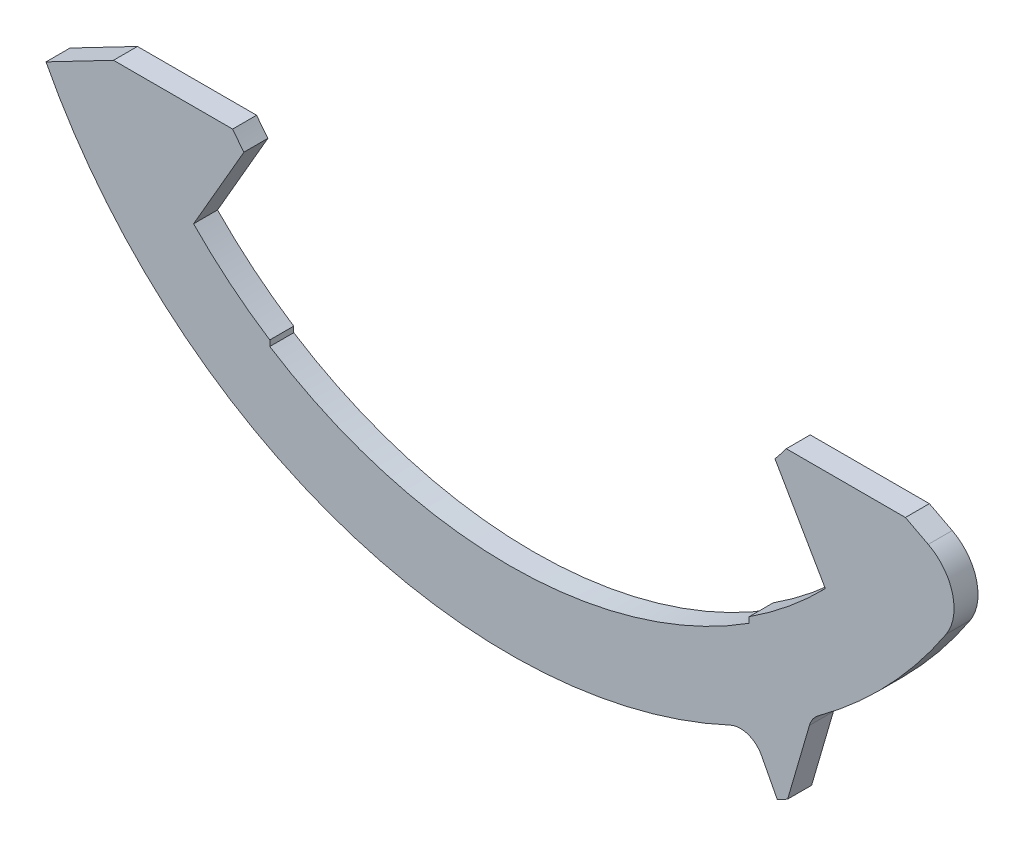
from build123d import *

# Parameters (mm, degrees)
OTHER_10076_5_DEPTH = 0.5
CUT_EXTRUDE1_START  = -0.5
CUT_EXTRUDE1_DEPTH  = 0.5


# Read off the part's stored shape, not the designer's step: 10076-5
with BuildPart() as part:
    # Other 10076-5 outline → Other 10076-5 (new body)
    with BuildSketch(Plane.XY):
        with BuildLine():
            ThreePointArc((7.573674013, -9.436602245), (7.668819519, -9.359444812), (7.763179028, -9.281328104))
            Line((7.763179028, -9.281328104), (7.919995926, -7.488902759))
            ThreePointArc((7.919995926, -7.488902759), (8.548470738, -6.76266575), (9.110578105, -5.983925684))
            ThreePointArc((9.110578105, -5.983925684), (9.242448569, -5.182849851), (8.736493865, -4.547930843))
            Line((8.736493865, -4.547930843), (8.260223146, -4.3))
            Line((8.260223146, -4.3), (5.774945887, -4.3))
            ThreePointArc((5.774945887, -4.3), (5.659072475, -4.451392897), (5.53923133, -4.5996648))
            Line((5.53923133, -4.5996648), (6.59, -6.419649523))
            ThreePointArc((6.59, -6.419649523), (5.831509763, -7.1157216), (5, -7.722693831))
            Line((5, -7.722693831), (5, -7.841555968))
            ThreePointArc((5, -7.841555968), (0, -9.3), (-5, -7.841555968))
            Line((-5, -7.841555968), (-5, -7.722693831))
            ThreePointArc((-5, -7.722693831), (-5.831509763, -7.1157216), (-6.59, -6.419649523))
            Line((-6.59, -6.419649523), (-5.53923133, -4.5996648))
            ThreePointArc((-5.53923133, -4.5996648), (-5.659072475, -4.451392897), (-5.774945887, -4.3))
            Line((-5.774945887, -4.3), (-8.260223146, -4.3))
            Line((-8.260223146, -4.3), (-10.732831081, -5.58715822))
            ThreePointArc((-10.732831081, -5.58715822), (-10.675718173, -5.6955282), (-10.617511084, -5.803314431))
            Line((-10.617511084, -5.803314431), (-9.055174855, -6.258693914))
            ThreePointArc((-9.055174855, -6.258693914), (-8.704696722, -6.64117368), (-8.882127626, -7.128661083))
            Line((-8.882127626, -7.128661083), (-9.436602245, -7.573674013))
            ThreePointArc((-9.436602245, -7.573674013), (-9.359444812, -7.668819519), (-9.281328104, -7.763179028))
            Line((-9.281328104, -7.763179028), (-7.660171598, -7.905011844))
            ThreePointArc((-7.660171598, -7.905011844), (-7.241809703, -8.211767477), (-7.320727248, -8.724502998))
            Line((-7.320727248, -8.724502998), (-7.777730077, -9.269137762))
            ThreePointArc((-7.777730077, -9.269137762), (-7.683493234, -9.347402405), (-7.588468891, -9.424709008))
            Line((-7.588468891, -9.424709008), (-5.970792243, -9.247544602))
            ThreePointArc((-5.970792243, -9.247544602), (-5.500623999, -9.466787654), (-5.477995427, -9.985067155))
            Line((-5.477995427, -9.985067155), (-5.819964104, -10.608393744))
            ThreePointArc((-5.819964104, -10.608393744), (-5.712269322, -10.666769858), (-5.603989074, -10.724052707))
            Line((-5.603989074, -10.724052707), (-4.05195869, -10.234699407))
            ThreePointArc((-4.05195869, -10.234699407), (-3.548052399, -10.358004491), (-3.424747314, -10.861910782))
            Line((-3.424747314, -10.861910782), (-3.638540174, -11.539975104))
            ThreePointArc((-3.638540174, -11.539975104), (-3.521526102, -11.576219327), (-3.404151099, -11.611277074))
            Line((-3.404151099, -11.611277074), (-1.977410637, -10.828540453))
            ThreePointArc((-1.977410637, -10.828540453), (-1.459131136, -10.851169025), (-1.239888083, -11.321337268))
            Line((-1.239888083, -11.321337268), (-1.317289186, -12.028081692))
            ThreePointArc((-1.317289186, -12.028081692), (-1.195452609, -12.04080118), (-1.073493507, -12.052286575))
            Line((-1.073493507, -12.052286575), (0.173128198, -11.006246762))
            ThreePointArc((0.173128198, -11.006246762), (0.685863719, -10.927329218), (0.992619352, -11.345691113))
            Line((0.992619352, -11.345691113), (1.054584487, -12.053955847))
            ThreePointArc((1.054584487, -12.053955847), (1.176561457, -12.042661796), (1.298417839, -12.030133462))
            Line((1.298417839, -12.030133462), (2.317013814, -10.760989181))
            ThreePointArc((2.317013814, -10.760989181), (2.804501216, -10.583558277), (3.186980982, -10.93403641))
            Line((3.186980982, -10.93403641), (3.38593107, -11.616603238))
            ThreePointArc((3.38593107, -11.616603238), (3.503360927, -11.581729673), (3.620431715, -11.545669067))
            Line((3.620431715, -11.545669067), (4.371857887, -10.10219282))
            ThreePointArc((4.371857887, -10.10219282), (4.815363304, -9.833067127), (5.258868721, -10.10219282))
            Line((5.258868721, -10.10219282), (5.58715822, -10.732831081))
            ThreePointArc((5.58715822, -10.732831081), (5.6955282, -10.675718173), (5.803314431, -10.617511084))
            Line((5.803314431, -10.617511084), (6.258693914, -9.055174855))
            ThreePointArc((6.258693914, -9.055174855), (6.64117368, -8.704696722), (7.128661083, -8.882127626))
            Line((7.128661083, -8.882127626), (7.573674013, -9.436602245))
        make_face()
    extrude(amount=OTHER_10076_5_DEPTH)

    # Sketch1 → Cut-Extrude1 (cut)
    with BuildSketch(Plane.XY.offset(0.5).offset(CUT_EXTRUDE1_START)):
        with BuildLine():
            Line((-9.668418082, -5.033059884), (-10.732831081, -5.58715822))
            ThreePointArc((-10.732831081, -5.58715822), (-4.639236905, -11.175306749), (3.620431715, -11.545669067))
            Line((3.620431715, -11.545669067), (4.371857887, -10.10219282))
            ThreePointArc((4.371857887, -10.10219282), (4.469650209, -9.971843573), (4.604163159, -9.879862428))
            ThreePointArc((4.604163159, -9.879862428), (-3.50493127, -10.321117032), (-9.668418082, -5.033059884))
        make_face()
        with BuildLine():
            Line((7.573674013, -9.436602245), (7.128661083, -8.882127626))
            ThreePointArc((7.128661083, -8.882127626), (6.804041546, -8.699374782), (6.443160998, -8.791795969))
            ThreePointArc((6.443160998, -8.791795969), (7.211064546, -8.173771964), (7.919995926, -7.488902759))
            Line((7.919995926, -7.488902759), (7.763179028, -9.281328104))
            ThreePointArc((7.763179028, -9.281328104), (7.668819519, -9.359444812), (7.573674013, -9.436602245))
        make_face()
    extrude(amount=CUT_EXTRUDE1_DEPTH, mode=Mode.SUBTRACT)


solid = part.part
